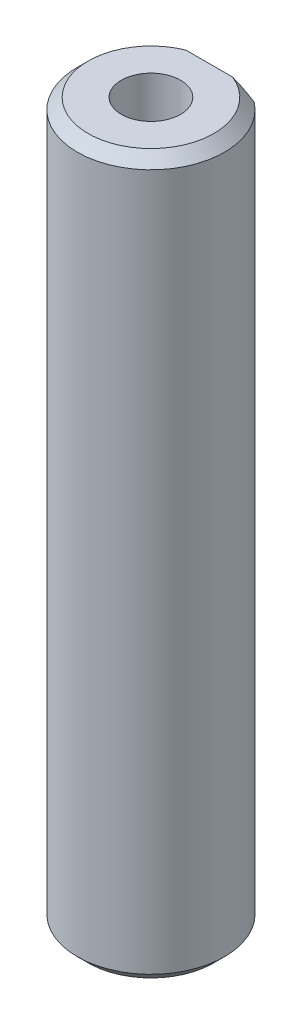
from build123d import *
from OCP.BRepAlgoAPI import BRepAlgoAPI_Cut
from OCP.TopTools import TopTools_ListOfShape

# Parameters (mm, degrees)
BOSS_EXTRUDE2_DEPTH       = 40
CUT_EXTRUDE1_START        = -7.349615
SKETCH2_R                 = 1.75
CUT_EXTRUDE1_DEPTH        = 4
F_1_0MM_DOWEL_HOLE1_D     = 3.3
F_1_0MM_DOWEL_HOLE1_DEPTH = 14.008579979
F_1_0MM_DOWEL_HOLE1_TIP   = 0.991420021
F_1_0MM_DOWEL_HOLE2_D     = 3.3
F_1_0MM_DOWEL_HOLE2_DEPTH = 14.008579979
F_1_0MM_DOWEL_HOLE2_TIP   = 0.991420021
CHAMFER1_SIZE             = 0.6
CHAMFER2_SIZE             = 0.6


with BuildPart() as part:
    # Sketch1 → Boss-Extrude2 (new body)
    with BuildSketch(Plane(origin=(0, 0, 0), x_dir=(1, 0, 0), z_dir=(0, 1, 0))):
        with BuildLine():
            Line((2.5, 3.249615362), (-2.5, 3.249615362))
            ThreePointArc((-2.5, 3.249615362), (0, -4.1), (2.5, 3.249615362))
        make_face()
    extrude(amount=BOSS_EXTRUDE2_DEPTH)


with BuildPart() as cut_extrude1_tool:
    # Sketch2 → Cut-Extrude1 (new body)
    with BuildSketch(Plane.XY.offset(4.1).offset(CUT_EXTRUDE1_START)):
        with Locations(Location((0, 20, 0), (0, 0, 180))):
            Circle(SKETCH2_R)
    extrude(amount=CUT_EXTRUDE1_DEPTH)


with BuildPart() as part_1:
    add(part.part)

    # Cut-Extrude1: cut by cut_extrude1_tool, with a tolerance
    cut_extrude1_stock = TopTools_ListOfShape()
    cut_extrude1_stock.Append(part_1.part.wrapped)
    cut_extrude1_tools = TopTools_ListOfShape()
    cut_extrude1_tools.Append(cut_extrude1_tool.part.wrapped)
    cut_extrude1_cut = BRepAlgoAPI_Cut()
    cut_extrude1_cut.SetArguments(cut_extrude1_stock)
    cut_extrude1_cut.SetTools(cut_extrude1_tools)
    cut_extrude1_cut.SetFuzzyValue(0.00001)
    cut_extrude1_cut.Build()
    add(Compound.cast(cut_extrude1_cut.Shape()).solids(), mode=Mode.REPLACE)

    # Ø1.0mm Dowel Hole1
    with Locations(Plane(origin=(0, 40, 0), x_dir=(1, 0, 0), z_dir=(0, 1, 0))):
        with Locations((0, 0)):
            Hole(F_1_0MM_DOWEL_HOLE1_D / 2, depth=F_1_0MM_DOWEL_HOLE1_DEPTH)
            with Locations((0, 0, -(F_1_0MM_DOWEL_HOLE1_DEPTH + F_1_0MM_DOWEL_HOLE1_TIP / 2))):  # 118° drill point
                Cone(0, F_1_0MM_DOWEL_HOLE1_D / 2, F_1_0MM_DOWEL_HOLE1_TIP, mode=Mode.SUBTRACT)

    # Ø1.0mm Dowel Hole2
    with Locations(Plane(origin=(0, 0, 0), x_dir=(-1, 0, 0), z_dir=(0, -1, 0))):
        with Locations((0, 0)):
            Hole(F_1_0MM_DOWEL_HOLE2_D / 2, depth=F_1_0MM_DOWEL_HOLE2_DEPTH)
            with Locations((0, 0, -(F_1_0MM_DOWEL_HOLE2_DEPTH + F_1_0MM_DOWEL_HOLE2_TIP / 2))):  # 118° drill point
                Cone(0, F_1_0MM_DOWEL_HOLE2_D / 2, F_1_0MM_DOWEL_HOLE2_TIP, mode=Mode.SUBTRACT)

    # Chamfer1
    chamfer1_edges = [part_1.edges().sort_by_distance(p)[0] for p in [
        (0, 40, 4.1),
    ]]
    chamfer(chamfer1_edges, length=CHAMFER1_SIZE)

    # Chamfer2
    chamfer2_edges = [part_1.edges().sort_by_distance(p)[0] for p in [
        (0, 0, 4.1),
    ]]
    chamfer(chamfer2_edges, length=CHAMFER2_SIZE)


solid = part_1.part
